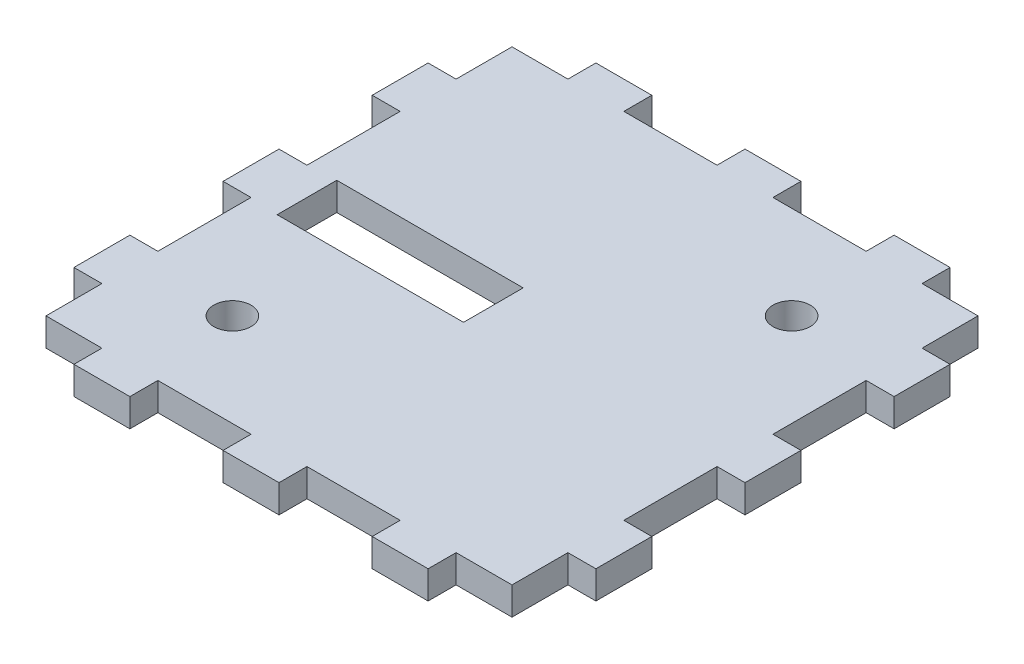
from build123d import *

# Parameters (mm, degrees)
BOSS_EXTRUDE1_DEPTH = 3
SKETCH2_R           = 2
SKETCH2_W           = 20
SKETCH2_H           = 6.4
CUT_EXTRUDE1_DEPTH  = 76.013332148


with BuildPart() as part:
    # Sketch1 → Boss-Extrude1 (new body)
    with BuildSketch(Plane(origin=(0, 0, 0), x_dir=(1, 0, 0), z_dir=(0, 1, 0))):
        Polygon((-50, 44), (-53, 44), (-53, 38), (-50, 38), (-50, 28), (-53, 28), (-53, 22), (-50, 22), (-50, 12), (-53, 12), (-53, 6), (-50, 6), (-50, 0), (-44, 0), (-44, -3), (-38, -3), (-38, 0), (-28, 0), (-28, -3), (-22, -3), (-22, 0), (-12, 0), (-12, -3), (-6, -3), (-6, 0), (0, 0), (0, 6), (3, 6), (3, 12), (0, 12), (0, 22), (3, 22), (3, 28), (0, 28), (0, 38), (3, 38), (3, 44), (0, 44), (0, 50), (-6, 50), (-6, 53), (-12, 53), (-12, 50), (-22, 50), (-22, 53), (-28, 53), (-28, 50), (-38, 50), (-38, 53), (-44, 53), (-44, 50), (-50, 50), align=None)
    extrude(amount=BOSS_EXTRUDE1_DEPTH)

    # Sketch2 → Cut-Extrude1 (cut, through all)
    with BuildSketch(Plane(origin=(0, 3, 0), x_dir=(1, 0, 0), z_dir=(0, 1, 0))):
        with Locations((-40, 10)):
            Circle(SKETCH2_R)
        with Locations((-10, 40)):
            Circle(SKETCH2_R)
        with Locations((-37, 25)):
            Rectangle(SKETCH2_W, SKETCH2_H)
    extrude(amount=-CUT_EXTRUDE1_DEPTH, mode=Mode.SUBTRACT)


solid = part.part
